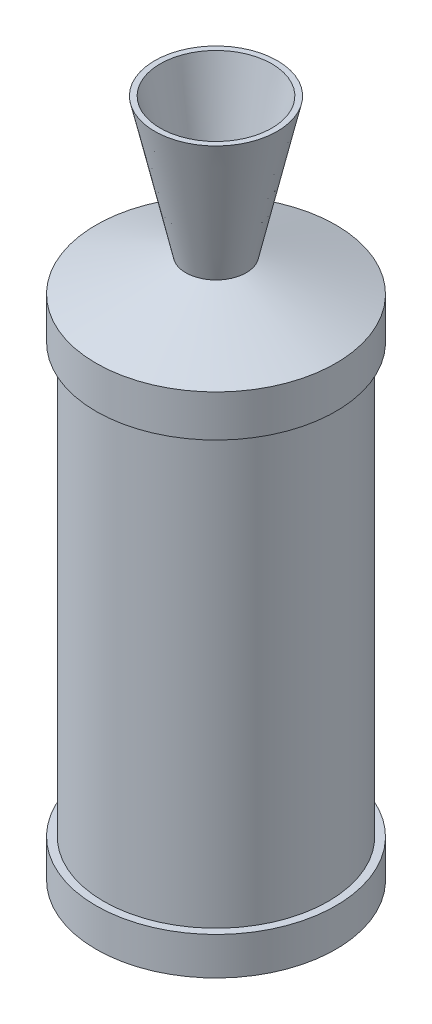
from build123d import *


with BuildPart() as part:
    # Sketch1 → Revolve1 (revolve)
    with BuildSketch(Plane.XY):
        with BuildLine():
            Line((0, 0), (19, 0))
            Line((19, 0), (102.37, 34.44))
            Line((102.37, 34.44), (109.297, 34.44))
            Line((109.297, 34.44), (109.297, 68.84))
            Line((109.297, 68.84), (102.37, 68.84))
            Line((102.37, 68.84), (102.37, 459.22))
            Line((102.37, 459.22), (109.297, 459.22))
            Line((109.297, 459.22), (109.297, 497.22))
            Line((109.297, 497.22), (27.555, 527.83))
            Line((27.555, 527.83), (55.87, 653.67))
            Line((55.87, 653.67), (50.87, 653.67))
            Line((50.87, 653.67), (31.620367249, 565.011883615))
            ThreePointArc((31.620367249, 565.011883615), (26.759732281, 552.987802652), (18.307547806, 543.150888862))
            ThreePointArc((18.307547806, 543.150888862), (13.904223764, 517.724343789), (38.232880309, 509.121150911))
            ThreePointArc((38.232880309, 509.121150911), (52.640140443, 511.702554255), (67.01150326, 508.928258207))
            Line((67.01150326, 508.928258207), (98.37, 497.22))
            Line((98.37, 497.22), (98.37, 34.44))
            Line((98.37, 34.44), (19, 4))
            Line((19, 4), (0, 4))
            Line((0, 4), (0, 0))
        make_face()
        Polygon((6.35, 12.7), (95.357036741, 42.653116777), (95.357036741, 491.600448224), (6.35, 508), align=None)
    revolve(axis=Axis((0, 0, 0), (0, 1, 0)))


solid = part.part
